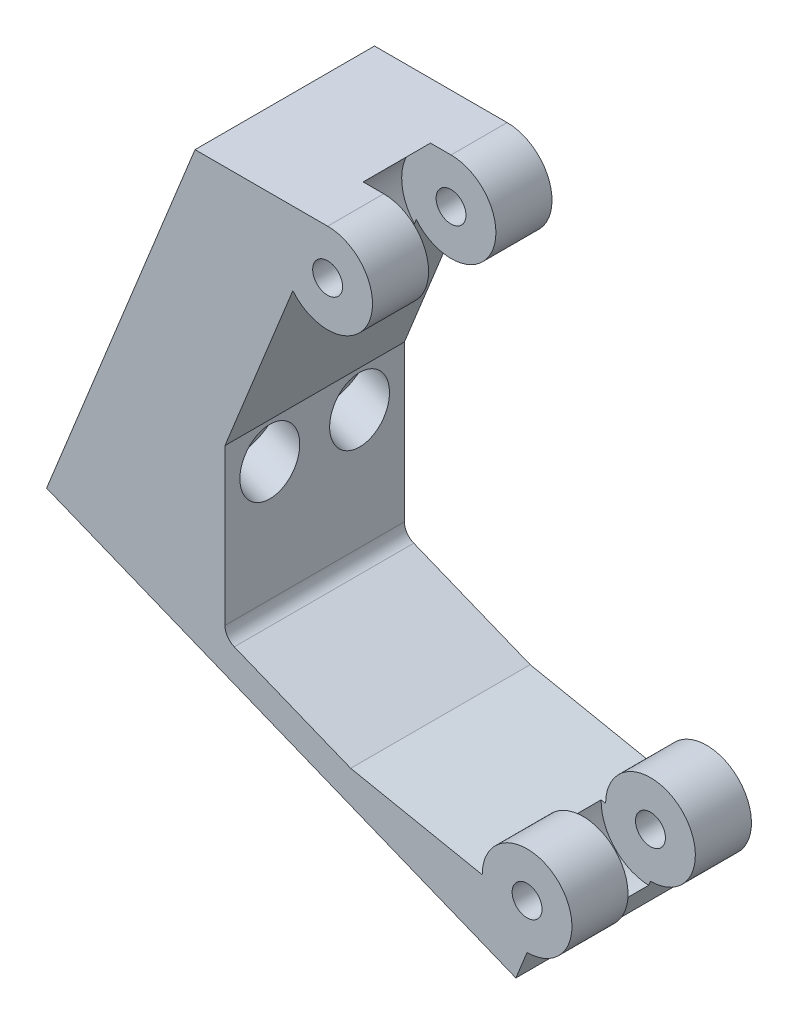
from build123d import *

# Parameters (mm, degrees)
SKETCH1_R                    = 1
BOSS_EXTRUDE1_DEPTH          = 12
CUT_EXTRUDE1_DEPTH           = 2.25
CUT_EXTRUDE1_DEPTH_BACK      = 2.25
SKETCH2_R                    = 3.3
FILLET3_R                    = 1
BOSS_EXTRUDE2_REACH          = 51.61
SKETCH4_W                    = 12
SKETCH4_H                    = 26.489515253
SCREW_SHAFT_HOLES_DEPTH      = 42.118659034
SCREW_SHAFT_HOLES_DEPTH_BACK = 42.118659034
HOLE_POSITIONS_R             = 1.2
CUT_EXTRUDE3_DEPTH           = 5
CUT_EXTRUDE3_DEPTH_BACK      = 1
SKETCH5_R                    = 2


with BuildPart() as part:
    # Sketch1 → Boss-Extrude1 (new body)
    with BuildSketch(Plane.XY):
        with BuildLine():
            Line((0, 6.640670196), (0, 35.210532713))
            Line((0, 35.210532713), (8.865440207, 35.210532713))
            ThreePointArc((8.865440207, 35.210532713), (11.575609349, 30.924071201), (6.541088012, 30.31385486))
            Line((6.541088012, 30.31385486), (2, 19.07426762))
            Line((2, 19.07426762), (2, 7.989687229))
            Line((2, 7.989687229), (10.406938735, 4.593063501))
            Line((10.406938735, 4.593063501), (19.199232805, 2.828667434))
            ThreePointArc((19.199232805, 2.828667434), (24.320553148, 4.949987778), (22.199232805, -0.171332566))
            Line((22.199232805, -0.171332566), (21.450019618, -2.025700275))
            Line((21.450019618, -2.025700275), (0, 6.640670196))
        make_face()
        with Locations((8.865440207, 32.210532713)):
            Circle(SKETCH1_R, mode=Mode.SUBTRACT)
        with Locations((22.199232805, 2.828667434)):
            Circle(SKETCH1_R, mode=Mode.SUBTRACT)
    extrude(amount=BOSS_EXTRUDE1_DEPTH)

    # Sketch2 → Cut-Extrude1 (cut, two sides: drawn at the far end of the back side and taken through both)
    with BuildSketch(Plane.XY.offset(6).offset(-CUT_EXTRUDE1_DEPTH_BACK)):
        with Locations((8.865440207, 32.210532713)):
            Circle(SKETCH2_R)
        with Locations((22.199232805, 2.828667434)):
            Circle(SKETCH2_R)
    extrude(amount=CUT_EXTRUDE1_DEPTH + CUT_EXTRUDE1_DEPTH_BACK, mode=Mode.SUBTRACT)

    # Fillet3
    fillet3_edges = [part.edges().sort_by_distance(p)[0] for p in [
        (2, 7.989687229, 6),
    ]]
    fillet(fillet3_edges, radius=FILLET3_R)

    # Boss-Extrude2: up to this face of the body (flat: up to its plane)
    boss_extrude2_end = Plane(part.part.faces().sort_by_distance((0, 20.925601454, 6))[0])
    # Sketch4 → Boss-Extrude2 (add, up to the picked face)
    with BuildSketch(Plane(origin=(-12.229645639, 4.941097571, 0), x_dir=(0, 0, -1), z_dir=(-0.9271838545667872, 0.37460659341591274, 0)), mode=Mode.PRIVATE) as boss_extrude2_sk1:
        with Locations((-6, -19.401879815)):
            Rectangle(SKETCH4_W, SKETCH4_H)
    boss_extrude2_tool1 = split(extrude(boss_extrude2_sk1.sketch, amount=-BOSS_EXTRUDE2_REACH, mode=Mode.PRIVATE), bisect_by=boss_extrude2_end, keep=Keep.BOTH, mode=Mode.PRIVATE)
    add(boss_extrude2_tool1.solids().sort_by(Axis((-4.961574, 22.930207, 6), (0.9271838545667872, -0.37460659341591274, 0)))[0])

    # Hole positions → Screw shaft holes (cut, two sides: drawn at the far end of the back side and taken through both)
    with BuildSketch(Plane(origin=(7.68361222, 33.141701506, 0), x_dir=(0, 0, -1), z_dir=(-0.927183854566786, 0.3746065934159158, 0)).offset(-SCREW_SHAFT_HOLES_DEPTH_BACK)):
        with Locations((-9, 17.420162392)):
            Circle(HOLE_POSITIONS_R)
        with Locations((-3, 17.420162392)):
            Circle(HOLE_POSITIONS_R)
        with Locations((-6, 6.887654186)):
            Circle(HOLE_POSITIONS_R)
    extrude(amount=SCREW_SHAFT_HOLES_DEPTH + SCREW_SHAFT_HOLES_DEPTH_BACK, mode=Mode.SUBTRACT)

    # Sketch5 → Cut-Extrude3 (cut, two sides: drawn at the far end of the back side and taken through both)
    with BuildSketch(Plane(origin=(-4.905710031, 1.982035509, 0), x_dir=(0, 0, -1), z_dir=(0.927183854566786, -0.3746065934159157, 0)).offset(-CUT_EXTRUDE3_DEPTH_BACK)):
        with Locations((-6, 26.719128162)):
            Circle(SKETCH5_R)
        with Locations((-9, 16.186619957)):
            Circle(SKETCH5_R)
        with Locations((-3, 16.186619957)):
            Circle(SKETCH5_R)
    extrude(amount=CUT_EXTRUDE3_DEPTH + CUT_EXTRUDE3_DEPTH_BACK, mode=Mode.SUBTRACT)


solid = part.part
